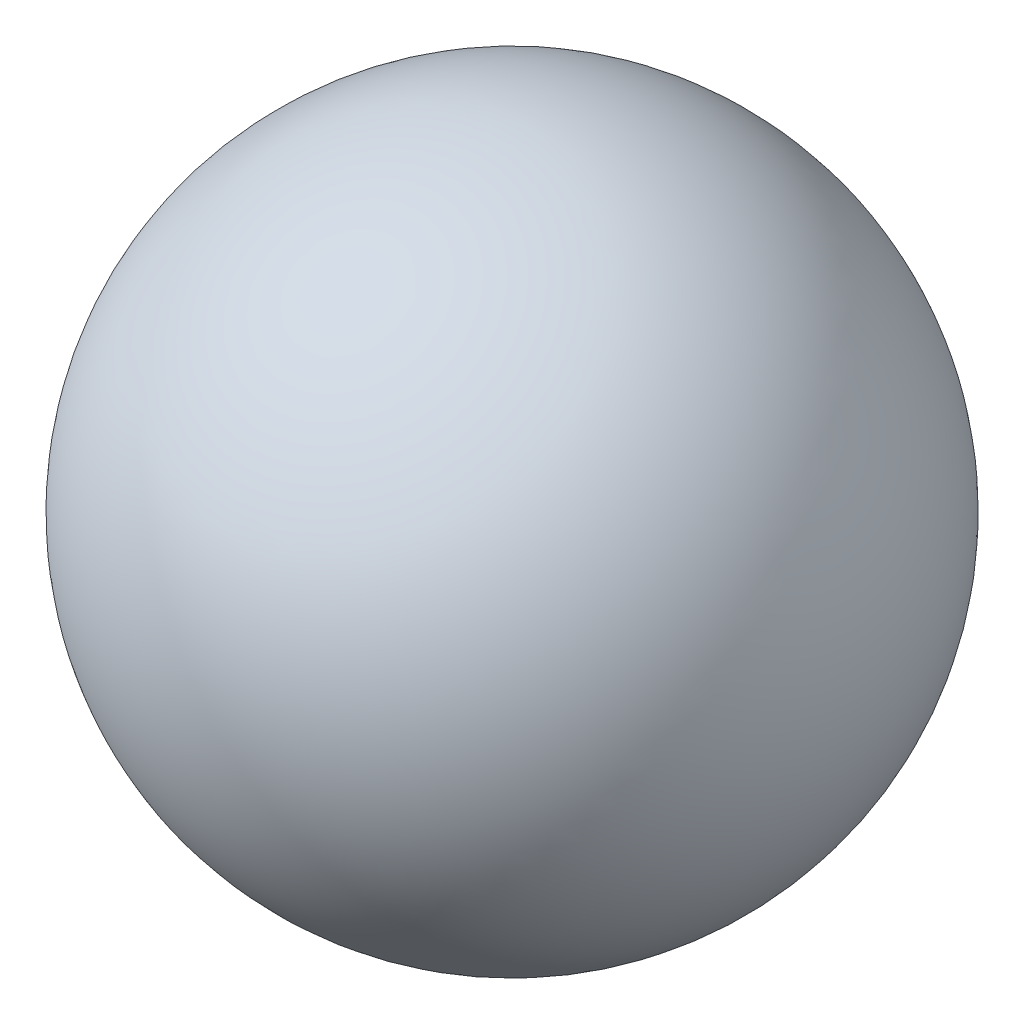
from build123d import *


with BuildPart() as part:
    # Sketch1 → Revolve1 (revolve)
    with BuildSketch(Plane(origin=(0, 0, 0), x_dir=(0, 0, -1), z_dir=(1, 0, 0))):
        with BuildLine():
            Line((-2.38, 0), (2.38, 0))
            ThreePointArc((2.38, 0), (0, 2.38), (-2.38, 0))
        make_face()
    revolve(axis=Axis((0, 0, 0), (0, 0, 1)))


solid = part.part
